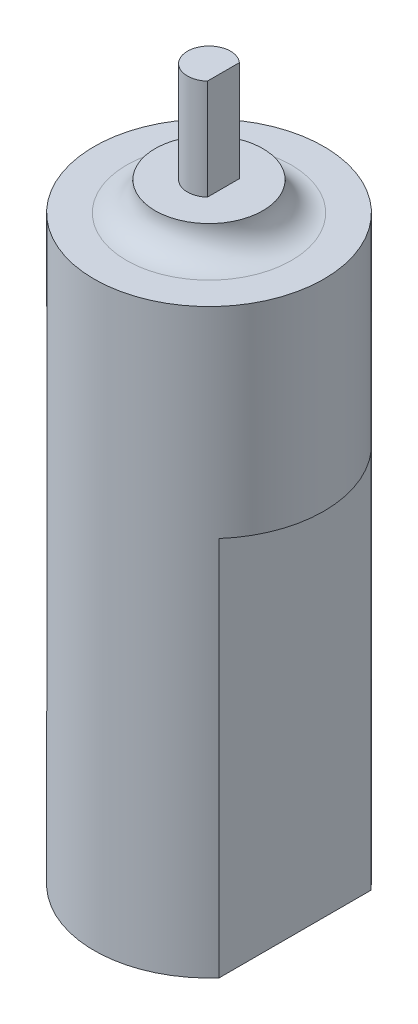
from build123d import *

# Parameters (mm, degrees)
SKETCH1_R           = 8
BOSS_EXTRUDE1_DEPTH = 40.5
SKETCH2_W           = 6
SKETCH2_H           = 10.583005244
CUT_EXTRUDE1_DEPTH  = 26.5
SKETCH3_R           = 3.75
BOSS_EXTRUDE2_DEPTH = 2
FILLET1_R           = 2
SKETCH4_R           = 1.5
BOSS_EXTRUDE3_DEPTH = 7
SKETCH5_W           = 0.5
SKETCH5_H           = 2.236067978
CUT_EXTRUDE2_DEPTH  = 7


with BuildPart() as part:
    # Sketch1 → Boss-Extrude1 (new body)
    with BuildSketch(Plane(origin=(0, 0, 0), x_dir=(1, 0, 0), z_dir=(0, 1, 0))):
        with Locations(Location((0, 0, 0), (0, 0, 270))):
            Circle(SKETCH1_R)
    extrude(amount=BOSS_EXTRUDE1_DEPTH)

    # Sketch2 → Cut-Extrude1 (cut)
    with BuildSketch(Plane(origin=(0, 0, 0), x_dir=(-1, 0, 0), z_dir=(0, -1, 0))):
        with Locations((9, 0)):
            Rectangle(SKETCH2_W, SKETCH2_H)
        with Locations((-9, 0)):
            Rectangle(SKETCH2_W, SKETCH2_H)
    extrude(amount=-CUT_EXTRUDE1_DEPTH, mode=Mode.SUBTRACT)

    # Sketch3 → Boss-Extrude2 (add)
    with BuildSketch(Plane(origin=(0, 40.5, 0), x_dir=(1, 0, 0), z_dir=(0, 1, 0))):
        with Locations(Location((0, 0, 0), (0, 0, 270))):
            Circle(SKETCH3_R)
    extrude(amount=BOSS_EXTRUDE2_DEPTH)

    # Fillet1
    fillet1_edges = [part.edges().sort_by_distance(p)[0] for p in [
        (0, 40.5, -3.75),
    ]]
    fillet(fillet1_edges, radius=FILLET1_R - 0.0001)  # a hair under: the kernel refuses the full size

    # Sketch4 → Boss-Extrude3 (add)
    with BuildSketch(Plane(origin=(0, 42.5, 0), x_dir=(1, 0, 0), z_dir=(0, 1, 0))):
        with Locations(Location((0, 0, 0), (0, 0, 270))):
            Circle(SKETCH4_R)
    extrude(amount=BOSS_EXTRUDE3_DEPTH)

    # Sketch5 → Cut-Extrude2 (cut)
    with BuildSketch(Plane(origin=(0, 49.5, 0), x_dir=(1, 0, 0), z_dir=(0, 1, 0))):
        with Locations((1.25, 0)):
            Rectangle(SKETCH5_W, SKETCH5_H)
    extrude(amount=-CUT_EXTRUDE2_DEPTH, mode=Mode.SUBTRACT)


solid = part.part
